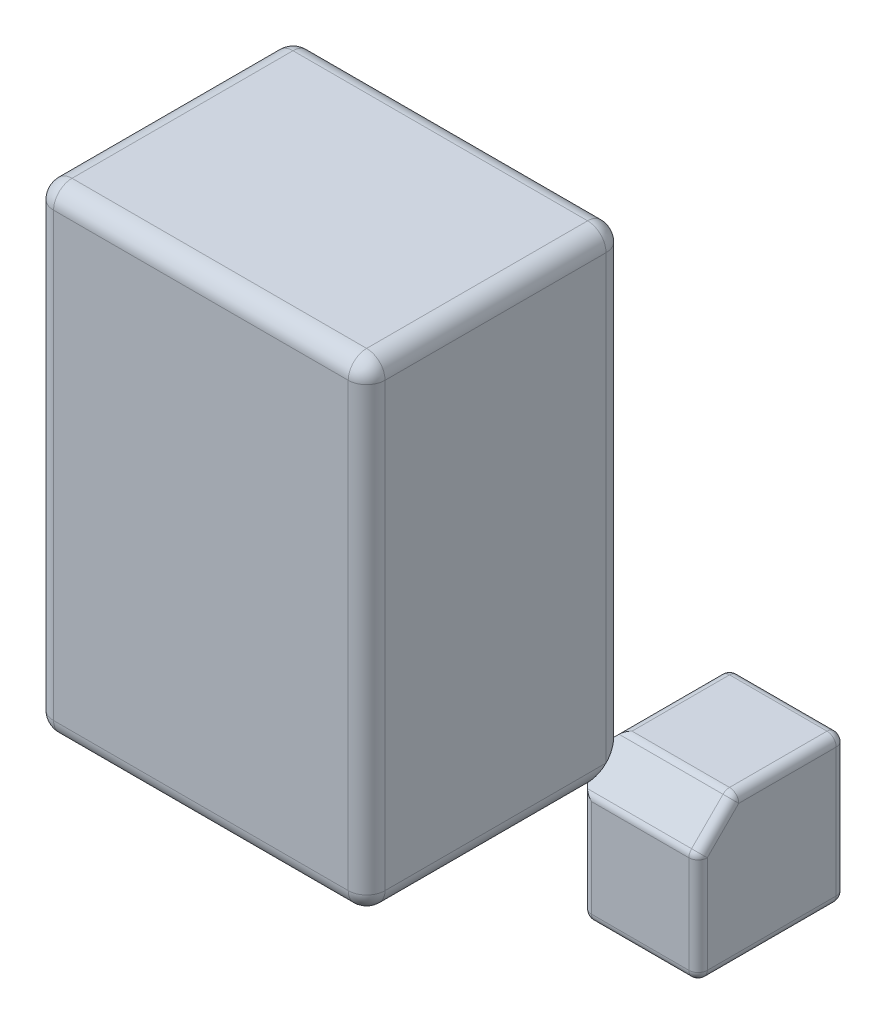
from build123d import *

# Parameters (mm, degrees)
SKETCH1_W                = 18
SKETCH1_H                = 26
BOSS_EXTRUDE1_DEPTH      = 14
SHELL1_T                 = 1
BOSS_EXTRUDE3_DEPTH      = 6
BOSS_EXTRUDE3_DEPTH_BACK = 2
SKETCH2_W                = 8
SKETCH2_H                = 8
CHAMFER2_SIZE            = 2
FILLET1_R                = 1
FILLET2_R                = 0.5


with BuildPart() as part:
    # Sketch1 → Boss-Extrude1 (new body)
    with BuildSketch(Plane.XY):
        with Locations((9, 13)):
            Rectangle(SKETCH1_W, SKETCH1_H)
    extrude(amount=BOSS_EXTRUDE1_DEPTH)

    # Shell1 (no face opened: a closed hollow body)
    add(offset(amount=-SHELL1_T, mode=Mode.PRIVATE), mode=Mode.SUBTRACT)

    # Sketch2 → Boss-Extrude3 (add, two sides: drawn at the far end of the back side and taken through both)
    with BuildSketch(Plane(origin=(0, 0, 0), x_dir=(-1, 0, 0), z_dir=(0, 0, -1)).offset(-BOSS_EXTRUDE3_DEPTH_BACK)):
        with Locations((-20, -2)):
            Rectangle(SKETCH2_W, SKETCH2_H)
    extrude(amount=BOSS_EXTRUDE3_DEPTH + BOSS_EXTRUDE3_DEPTH_BACK)

    # Chamfer2
    chamfer2_edges = [part.edges().sort_by_distance(p)[0] for p in [
        (16, -3, 2),
        (16, 2, -3),
        (21, 2, 2),
    ]]
    chamfer(chamfer2_edges, length=CHAMFER2_SIZE)

    # Fillet1
    # the kernel refuses this fillet: 1 mm, written as the material it takes off along each edge
    with BuildSketch(Plane(origin=(1, 25, 1), x_dir=(0, 1, 0), z_dir=(0, 0, -1))) as fillet1_piece_1_section:
        Polygon((0, 0), (FILLET1_R, 0), (FILLET1_R, -FILLET1_R), (0, -FILLET1_R), align=None)
    fillet1_piece_1 = extrude(amount=FILLET1_R, mode=Mode.PRIVATE)
    fillet1_piece_1 = fillet1_piece_1 - Plane(origin=(1, 25, 1), x_dir=(0.7071067811865475, -0.7071067811865477, 0), z_dir=(0, 0, -1)) * Sphere(FILLET1_R, mode=Mode.PRIVATE)
    add(fillet1_piece_1, mode=Mode.SUBTRACT)
    with BuildSketch(Plane(origin=(1, 1, 1), x_dir=(0, 0, -1), z_dir=(0, -1, 0))) as fillet1_piece_2_section:
        Polygon((0, 0), (FILLET1_R, 0), (FILLET1_R, -FILLET1_R), (0, -FILLET1_R), align=None)
    fillet1_piece_2 = extrude(amount=FILLET1_R, mode=Mode.PRIVATE)
    fillet1_piece_2 = fillet1_piece_2 - Plane(origin=(1, 1, 1), x_dir=(0.7071067811865475, 0, 0.7071067811865475), z_dir=(0, -1, 0)) * Sphere(FILLET1_R, mode=Mode.PRIVATE)
    add(fillet1_piece_2, mode=Mode.SUBTRACT)
    with BuildSketch(Plane(origin=(17, 25, 1), x_dir=(0, 0, -1), z_dir=(0, 1, 0))) as fillet1_piece_3_section:
        Polygon((0, 0), (FILLET1_R, 0), (FILLET1_R, -FILLET1_R), (0, -FILLET1_R), align=None)
    fillet1_piece_3 = extrude(amount=FILLET1_R, mode=Mode.PRIVATE)
    fillet1_piece_3 = fillet1_piece_3 - Plane(origin=(17, 25, 1), x_dir=(-0.7071067811865475, 0, 0.7071067811865475), z_dir=(0, 1, 0)) * Sphere(FILLET1_R, mode=Mode.PRIVATE)
    add(fillet1_piece_3, mode=Mode.SUBTRACT)
    with BuildSketch(Plane(origin=(1, 1, 13), x_dir=(-1, 0, 0), z_dir=(0, -1, 0))) as fillet1_piece_4_section:
        Polygon((0, 0), (FILLET1_R, 0), (FILLET1_R, -FILLET1_R), (0, -FILLET1_R), align=None)
    fillet1_piece_4 = extrude(amount=FILLET1_R, mode=Mode.PRIVATE)
    fillet1_piece_4 = fillet1_piece_4 - Plane(origin=(1, 1, 13), x_dir=(0.7071067811865475, 0, -0.7071067811865475), z_dir=(0, -1, 0)) * Sphere(FILLET1_R, mode=Mode.PRIVATE)
    add(fillet1_piece_4, mode=Mode.SUBTRACT)
    with BuildSketch(Plane(origin=(17, 1, 13), x_dir=(1, 0, 0), z_dir=(0, -1, 0))) as fillet1_piece_5_section:
        Polygon((0, 0), (FILLET1_R, 0), (FILLET1_R, FILLET1_R), (0, FILLET1_R), align=None)
    fillet1_piece_5 = extrude(amount=FILLET1_R, mode=Mode.PRIVATE)
    fillet1_piece_5 = fillet1_piece_5 - Plane(origin=(17, 1, 13), x_dir=(-0.7071067811865475, 0, -0.7071067811865475), z_dir=(0, -1, 0)) * Sphere(FILLET1_R, mode=Mode.PRIVATE)
    add(fillet1_piece_5, mode=Mode.SUBTRACT)
    with BuildSketch(Plane(origin=(17, 25, 13), x_dir=(1, 0, 0), z_dir=(0, 1, 0))) as fillet1_piece_6_section:
        Polygon((0, 0), (FILLET1_R, 0), (FILLET1_R, -FILLET1_R), (0, -FILLET1_R), align=None)
    fillet1_piece_6 = extrude(amount=FILLET1_R, mode=Mode.PRIVATE)
    fillet1_piece_6 = fillet1_piece_6 - Plane(origin=(17, 25, 13), x_dir=(-0.7071067811865475, 0, -0.7071067811865475), z_dir=(0, 1, 0)) * Sphere(FILLET1_R, mode=Mode.PRIVATE)
    add(fillet1_piece_6, mode=Mode.SUBTRACT)
    with BuildSketch(Plane(origin=(1, 25, 13), x_dir=(-1, 0, 0), z_dir=(0, 1, 0))) as fillet1_piece_7_section:
        Polygon((0, 0), (FILLET1_R, 0), (FILLET1_R, FILLET1_R), (0, FILLET1_R), align=None)
    fillet1_piece_7 = extrude(amount=FILLET1_R, mode=Mode.PRIVATE)
    fillet1_piece_7 = fillet1_piece_7 - Plane(origin=(1, 25, 13), x_dir=(0.7071067811865475, 0, -0.7071067811865475), z_dir=(0, 1, 0)) * Sphere(FILLET1_R, mode=Mode.PRIVATE)
    add(fillet1_piece_7, mode=Mode.SUBTRACT)
    with BuildSketch(Plane(origin=(0, 25, 0), x_dir=(1, 0, 0), z_dir=(0, -1, 0)), Plane(origin=(18, 1, 14), x_dir=(0, 0, -1), z_dir=(0, 1, 0)), Plane(origin=(0, 25, 14), x_dir=(0, 0, -1), z_dir=(0, -1, 0))) as fillet1_piece_8:
        with BuildLine():
            CenterArc((FILLET1_R, FILLET1_R), FILLET1_R, 180, 90)
            Line((0, FILLET1_R), (0, 0))
            Line((0, 0), (FILLET1_R, 0))
        make_face()
    extrude(amount=24, mode=Mode.SUBTRACT)
    with BuildSketch(Plane(origin=(1, 0, 0), x_dir=(0, 0, 1), z_dir=(1, 0, 0))) as fillet1_piece_9_section:
        with BuildLine():
            CenterArc((FILLET1_R, -FILLET1_R), FILLET1_R, 90, 90)
            Line((0, -FILLET1_R), (0, 0))
            Line((0, 0), (FILLET1_R, 0))
        make_face()
    fillet1_piece_9 = extrude(amount=17.5, mode=Mode.PRIVATE)
    fillet1_piece_9 = split(fillet1_piece_9, bisect_by=Plane(origin=(12.381861728, 0.226424858, -3.618138272), z_dir=(-0.7071067811865476, 0, 0.7071067811865476)), keep=Keep.TOP, mode=Mode.PRIVATE)
    fillet1_piece_9 = split(fillet1_piece_9, bisect_by=Plane(origin=(12.381861728, -3.618138272, 0.226424858), z_dir=(-0.7071067811865476, 0.7071067811865476, 0)), keep=Keep.TOP, mode=Mode.PRIVATE)
    add(fillet1_piece_9, mode=Mode.SUBTRACT)
    with BuildSketch(Plane(origin=(1, 0, 0), x_dir=(0, 0, 1), z_dir=(1, 0, 0))) as fillet1_piece_10_section:
        with BuildLine():
            CenterArc((FILLET1_R, -FILLET1_R), FILLET1_R, 90, 90)
            Line((0, -FILLET1_R), (0, 0))
            Line((0, 0), (FILLET1_R, 0))
        make_face()
    fillet1_piece_10 = extrude(amount=17.5, mode=Mode.PRIVATE)
    fillet1_piece_10 = split(fillet1_piece_10, bisect_by=Plane(origin=(16.16446835, 0.528927527, 0.16446835), z_dir=(0.7071067811865476, 0, -0.7071067811865476)), keep=Keep.TOP, mode=Mode.PRIVATE)
    fillet1_piece_10 = split(fillet1_piece_10, bisect_by=Plane(origin=(16.407441135, 0.407441135, 0.042981958), z_dir=(-0.7071067811865476, 0.7071067811865476, 0)), keep=Keep.TOP, mode=Mode.PRIVATE)
    add(fillet1_piece_10, mode=Mode.SUBTRACT)
    with BuildSketch(Plane(origin=(1, 0, 0), x_dir=(0, 0, 1), z_dir=(1, 0, 0))) as fillet1_piece_11_section:
        with BuildLine():
            CenterArc((FILLET1_R, -FILLET1_R), FILLET1_R, 90, 90)
            Line((0, -FILLET1_R), (0, 0))
            Line((0, 0), (FILLET1_R, 0))
        make_face()
    fillet1_piece_11 = extrude(amount=17.5, mode=Mode.PRIVATE)
    fillet1_piece_11 = split(fillet1_piece_11, bisect_by=Plane(origin=(16.407441135, 0.042981958, 0.407441135), z_dir=(-0.7071067811865476, 0, 0.7071067811865476)), keep=Keep.TOP, mode=Mode.PRIVATE)
    fillet1_piece_11 = split(fillet1_piece_11, bisect_by=Plane(origin=(16.16446835, 0.16446835, 0.528927527), z_dir=(0.7071067811865476, -0.7071067811865476, 0)), keep=Keep.TOP, mode=Mode.PRIVATE)
    add(fillet1_piece_11, mode=Mode.SUBTRACT)
    with BuildSketch(Plane(origin=(18, -0.5, 0), x_dir=(-1, 0, 0), z_dir=(0, 1, 0))) as fillet1_piece_12_section:
        with BuildLine():
            CenterArc((FILLET1_R, FILLET1_R), FILLET1_R, 180, 90)
            Line((0, FILLET1_R), (0, 0))
            Line((0, 0), (FILLET1_R, 0))
        make_face()
    fillet1_piece_12 = extrude(amount=25.5, mode=Mode.PRIVATE)
    fillet1_piece_12 = split(fillet1_piece_12, bisect_by=Plane(origin=(17.83553165, 1.83553165, 0.528927527), z_dir=(0.7071067811865476, -0.7071067811865476, 0)), keep=Keep.TOP, mode=Mode.PRIVATE)
    fillet1_piece_12 = split(fillet1_piece_12, bisect_by=Plane(origin=(17.957018042, 1.592558865, 0.407441135), z_dir=(0, 0.7071067811865476, 0.7071067811865476)), keep=Keep.TOP, mode=Mode.PRIVATE)
    add(fillet1_piece_12, mode=Mode.SUBTRACT)
    with BuildSketch(Plane(origin=(18, -0.5, 0), x_dir=(-1, 0, 0), z_dir=(0, 1, 0))) as fillet1_piece_13_section:
        with BuildLine():
            CenterArc((FILLET1_R, FILLET1_R), FILLET1_R, 180, 90)
            Line((0, FILLET1_R), (0, 0))
            Line((0, 0), (FILLET1_R, 0))
        make_face()
    fillet1_piece_13 = extrude(amount=25.5, mode=Mode.PRIVATE)
    fillet1_piece_13 = split(fillet1_piece_13, bisect_by=Plane(origin=(17.592558865, 1.592558865, 0.042981958), z_dir=(-0.7071067811865476, 0.7071067811865476, 0)), keep=Keep.TOP, mode=Mode.PRIVATE)
    fillet1_piece_13 = split(fillet1_piece_13, bisect_by=Plane(origin=(17.471072473, 1.83553165, 0.16446835), z_dir=(0, -0.7071067811865476, -0.7071067811865476)), keep=Keep.TOP, mode=Mode.PRIVATE)
    add(fillet1_piece_13, mode=Mode.SUBTRACT)
    with BuildSketch(Plane(origin=(18, -0.5, 0), x_dir=(-1, 0, 0), z_dir=(0, 1, 0))) as fillet1_piece_14_section:
        with BuildLine():
            CenterArc((FILLET1_R, FILLET1_R), FILLET1_R, 180, 90)
            Line((0, FILLET1_R), (0, 0))
            Line((0, 0), (FILLET1_R, 0))
        make_face()
    fillet1_piece_14 = extrude(amount=25.5, mode=Mode.PRIVATE)
    fillet1_piece_14 = split(fillet1_piece_14, bisect_by=Plane(origin=(23.618173362, 7.618173362, 0.226414546), z_dir=(-0.7071067811865476, 0.7071067811865476, 0)), keep=Keep.TOP, mode=Mode.PRIVATE)
    fillet1_piece_14 = split(fillet1_piece_14, bisect_by=Plane(origin=(17.773585454, 7.618173362, -5.618173362), z_dir=(0, 0.7071067811865476, 0.7071067811865476)), keep=Keep.TOP, mode=Mode.PRIVATE)
    add(fillet1_piece_14, mode=Mode.SUBTRACT)
    with BuildSketch(Plane(origin=(17, 26, 0), x_dir=(0, -1, 0), z_dir=(-1, 0, 0)), Plane(origin=(1, 0, 14), x_dir=(0, 0, -1), z_dir=(1, 0, 0))) as fillet1_piece_15:
        with BuildLine():
            CenterArc((FILLET1_R, FILLET1_R), FILLET1_R, 180, 90)
            Line((0, FILLET1_R), (0, 0))
            Line((0, 0), (FILLET1_R, 0))
        make_face()
    extrude(amount=16, mode=Mode.SUBTRACT)
    with BuildSketch(Plane(origin=(17, 26, 14), x_dir=(0, -1, 0), z_dir=(-1, 0, 0))) as fillet1_piece_16:
        with BuildLine():
            CenterArc((FILLET1_R, -FILLET1_R), FILLET1_R, 90, 90)
            Line((0, -FILLET1_R), (0, 0))
            Line((0, 0), (FILLET1_R, 0))
        make_face()
    extrude(amount=16, mode=Mode.SUBTRACT)
    with BuildSketch(Plane(origin=(0, 26, 1), x_dir=(0, -1, 0), z_dir=(0, 0, 1)), Plane(origin=(0, 0, 1), x_dir=(1, 0, 0), z_dir=(0, 0, 1))) as fillet1_piece_17:
        with BuildLine():
            CenterArc((FILLET1_R, FILLET1_R), FILLET1_R, 180, 90)
            Line((0, FILLET1_R), (0, 0))
            Line((0, 0), (FILLET1_R, 0))
        make_face()
    extrude(amount=12, mode=Mode.SUBTRACT)
    with BuildSketch(Plane(origin=(18, 26, 1), x_dir=(0, -1, 0), z_dir=(0, 0, 1))) as fillet1_piece_18:
        with BuildLine():
            CenterArc((FILLET1_R, -FILLET1_R), FILLET1_R, 90, 90)
            Line((0, -FILLET1_R), (0, 0))
            Line((0, 0), (FILLET1_R, 0))
        make_face()
    extrude(amount=12, mode=Mode.SUBTRACT)
    with BuildSketch(Plane(origin=(18, 0, -0.5), x_dir=(-1, 0, 0), z_dir=(0, 0, 1))) as fillet1_piece_19_section:
        with BuildLine():
            CenterArc((FILLET1_R, -FILLET1_R), FILLET1_R, 90, 90)
            Line((0, -FILLET1_R), (0, 0))
            Line((0, 0), (FILLET1_R, 0))
        make_face()
    fillet1_piece_19 = extrude(amount=13.5, mode=Mode.PRIVATE)
    fillet1_piece_19 = split(fillet1_piece_19, bisect_by=Plane(origin=(17.83553165, 0.528927527, 1.83553165), z_dir=(0.7071067811865476, 0, -0.7071067811865476)), keep=Keep.TOP, mode=Mode.PRIVATE)
    fillet1_piece_19 = split(fillet1_piece_19, bisect_by=Plane(origin=(17.957018042, 0.407441135, 1.592558865), z_dir=(0, 0.7071067811865476, 0.7071067811865476)), keep=Keep.TOP, mode=Mode.PRIVATE)
    add(fillet1_piece_19, mode=Mode.SUBTRACT)
    with BuildSketch(Plane(origin=(18, 0, -0.5), x_dir=(-1, 0, 0), z_dir=(0, 0, 1))) as fillet1_piece_20_section:
        with BuildLine():
            CenterArc((FILLET1_R, -FILLET1_R), FILLET1_R, 90, 90)
            Line((0, -FILLET1_R), (0, 0))
            Line((0, 0), (FILLET1_R, 0))
        make_face()
    fillet1_piece_20 = extrude(amount=13.5, mode=Mode.PRIVATE)
    fillet1_piece_20 = split(fillet1_piece_20, bisect_by=Plane(origin=(17.592558865, 0.042981958, 1.592558865), z_dir=(-0.7071067811865476, 0, 0.7071067811865476)), keep=Keep.TOP, mode=Mode.PRIVATE)
    fillet1_piece_20 = split(fillet1_piece_20, bisect_by=Plane(origin=(17.471072473, 0.16446835, 1.83553165), z_dir=(0, -0.7071067811865476, -0.7071067811865476)), keep=Keep.TOP, mode=Mode.PRIVATE)
    add(fillet1_piece_20, mode=Mode.SUBTRACT)
    with BuildSketch(Plane(origin=(18, 0, -0.5), x_dir=(-1, 0, 0), z_dir=(0, 0, 1))) as fillet1_piece_21_section:
        with BuildLine():
            CenterArc((FILLET1_R, -FILLET1_R), FILLET1_R, 90, 90)
            Line((0, -FILLET1_R), (0, 0))
            Line((0, 0), (FILLET1_R, 0))
        make_face()
    fillet1_piece_21 = extrude(amount=13.5, mode=Mode.PRIVATE)
    fillet1_piece_21 = split(fillet1_piece_21, bisect_by=Plane(origin=(20.618101716, 0.226435602, 4.618101716), z_dir=(-0.7071067811865476, 0, 0.7071067811865476)), keep=Keep.TOP, mode=Mode.PRIVATE)
    fillet1_piece_21 = split(fillet1_piece_21, bisect_by=Plane(origin=(17.773564398, -2.618101716, 4.618101716), z_dir=(0, 0.7071067811865476, 0.7071067811865476)), keep=Keep.TOP, mode=Mode.PRIVATE)
    add(fillet1_piece_21, mode=Mode.SUBTRACT)

    # Fillet2
    fillet2_edges = [part.edges().sort_by_distance(p)[0] for p in [
        (20, -6, -6),
        (24, -6, -2),
        (24, -2, -6),
        (24, 2, -3),
        (21, 2, -6),
        (18, 2, -3),
        (21, 2, 0),
        (24, -3, 2),
        (24, 1, 1),
        (21, -6, 2),
        (18, -3, 2),
        (21, 0, 2),
        (16, -3, -6),
        (16, -6, -3),
        (16, -3, 0),
        (16, 0, -3),
        (17, 1, -6),
        (17, -6, 1),
    ]]
    fillet(fillet2_edges, radius=FILLET2_R)


solid = part.part
